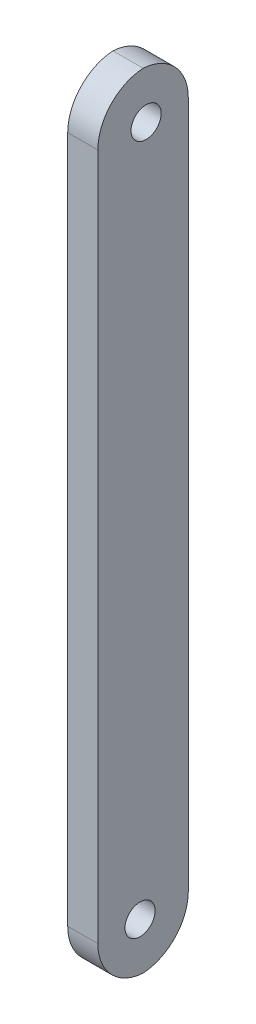
from build123d import *

# Parameters (mm, degrees)
ESQUISSE1_W             = 5
ESQUISSE1_H             = 130
BOSS_EXTRU_1_DEPTH      = 15
CONG_1_R                = 8
ESQUISSE2_R             = 2.5
ENL_V_MAT_EXTRU_1_DEPTH = 15


with BuildPart() as part:
    # Esquisse1 → Boss.-Extru.1 (new body)
    with BuildSketch(Plane.XY):
        with Locations((2.5, 65)):
            Rectangle(ESQUISSE1_W, ESQUISSE1_H)
    extrude(amount=BOSS_EXTRU_1_DEPTH)

    # Congé1
    # the kernel refuses this fillet: 8 mm, written as the material it takes off along each edge
    with BuildSketch(Plane(origin=(-20, 0, 15), x_dir=(0, 0, -1), z_dir=(1, 0, 0)), Plane(origin=(25, 130, 15), x_dir=(0, 0, -1), z_dir=(-1, 0, 0))) as cong_1_piece_1:
        with BuildLine():
            CenterArc((CONG_1_R, CONG_1_R), CONG_1_R, 180, 90)
            Line((0, CONG_1_R), (0, 0))
            Line((0, 0), (CONG_1_R, 0))
        make_face()
    extrude(amount=45, mode=Mode.SUBTRACT)
    with BuildSketch(Plane(origin=(-20, 0, 0), x_dir=(0, 0, 1), z_dir=(1, 0, 0)), Plane(origin=(25, 130, 0), x_dir=(0, 0, 1), z_dir=(-1, 0, 0))) as cong_1_piece_2:
        with BuildLine():
            CenterArc((CONG_1_R, -CONG_1_R), CONG_1_R, 90, 90)
            Line((0, -CONG_1_R), (0, 0))
            Line((0, 0), (CONG_1_R, 0))
        make_face()
    extrude(amount=45, mode=Mode.SUBTRACT)

    # Esquisse2 → Enlèv. mat.-Extru.1 (cut)
    with BuildSketch(Plane(origin=(5, 0, 0), x_dir=(0, 0, -1), z_dir=(1, 0, 0))):
        with Locations((-7, 122)):
            Circle(ESQUISSE2_R)
        with Locations((-8, 8)):
            Circle(ESQUISSE2_R)
    extrude(amount=-ENL_V_MAT_EXTRU_1_DEPTH, mode=Mode.SUBTRACT)


solid = part.part
